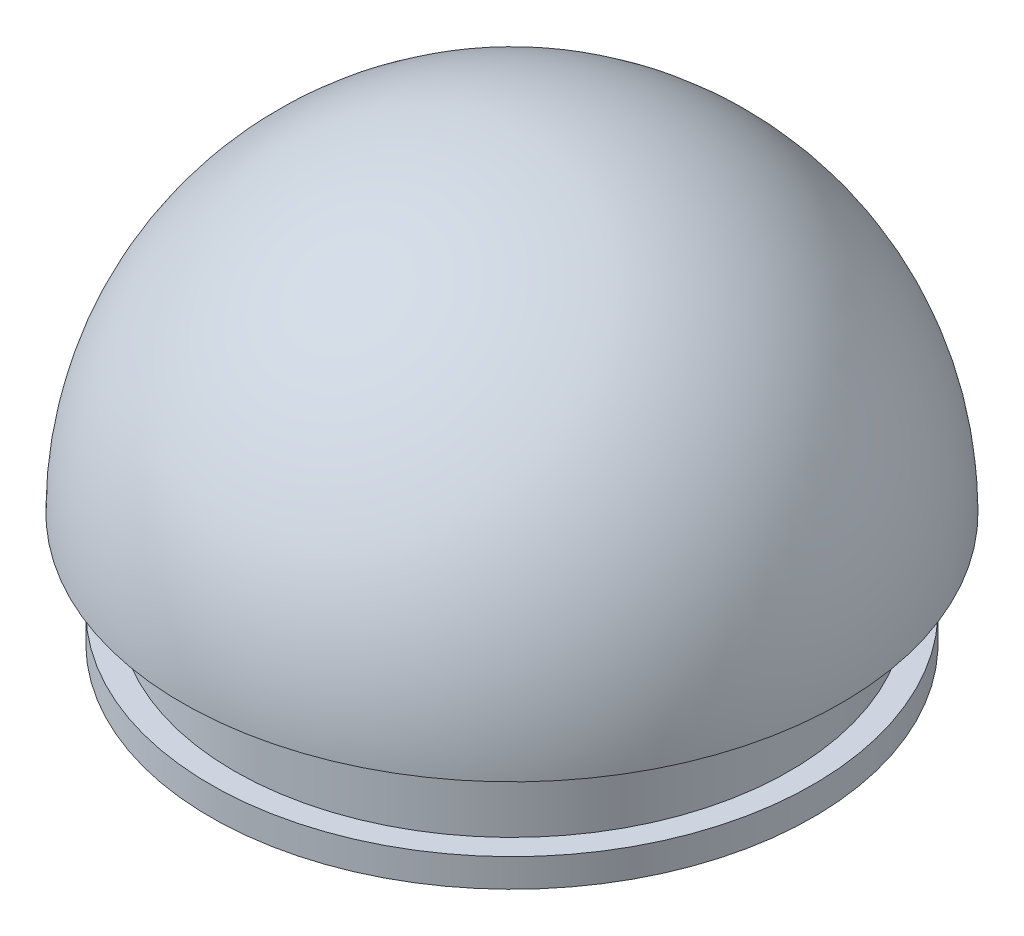
from build123d import *
from build123d.topology import SkipClean

# Parameters (mm, degrees)
CUT_REVOLVE2_ANGLE      = 180
BOSS_EXTRUDE1_START     = -0.0001
BOSS_EXTRUDE1_OUTLINE_R = 33.75
BOSS_EXTRUDE1_DEPTH     = 3.0001
SKETCH7_R               = 29.5
BOSS_EXTRUDE2_DEPTH     = 12
SKETCH8_R               = 32
BOSS_EXTRUDE3_DEPTH     = 3
SKETCH9_R               = 28
CUT_EXTRUDE1_DEPTH      = 16


# Read off the part's stored shape, not the designer's step: Boss-Extrude1
with BuildPart() as part:
    # Sketch1 → Revolve1 (revolve)
    with BuildSketch(Plane.XY):
        with BuildLine():
            Line((35, 0), (-35, 0))
            ThreePointArc((-35, 0), (0, 35), (35, 0))
        make_face()
    revolve(axis=Axis((35, 0, 0), (-1, 0, 0)))

    # Sketch3 → Cut-Revolve1 (revolve, cut)
    with BuildSketch(Plane.XY):
        with BuildLine():
            Line((0.536808441, 33.745730644), (-0.536808441, -33.745730644))
            ThreePointArc((-0.536808441, -33.745730644), (-33.745730644, 0.536808441), (0.536808441, 33.745730644))
        make_face()
    revolve(axis=Axis((0.536808441, 33.745730644, 0), (-0.015905435294566866, -0.9998735005629914, 0)), mode=Mode.SUBTRACT)

    # Sketch5 → Cut-Revolve2 (revolve, cut)
    with SkipClean():  # the faces are left unmerged after this step: merging them gives an invalid solid
        with BuildSketch(Plane(origin=(0, 0, 0), x_dir=(1, 0, 0), z_dir=(0, 1, 0))):
            with BuildLine():
                Line((-35, 0), (35, 0))
                ThreePointArc((35, 0), (0, -35), (-35, 0))
            make_face()
        revolve(axis=Axis((-35, 0, 0), (1, 0, 0)), revolution_arc=CUT_REVOLVE2_ANGLE, mode=Mode.SUBTRACT)

    # Boss-Extrude1 outline → Boss-Extrude1 (add)
    with SkipClean():  # the faces are left unmerged after this step: merging them gives an invalid solid
        with BuildSketch(Plane(origin=(0, 0, 0), x_dir=(1, 0, 0), z_dir=(0, 1, 0)).offset(BOSS_EXTRUDE1_START)):
            Circle(BOSS_EXTRUDE1_OUTLINE_R)
        extrude(amount=BOSS_EXTRUDE1_DEPTH)

    # Sketch7 → Boss-Extrude2 (add)
    with SkipClean():  # the faces are left unmerged after this step: merging them gives an invalid solid
        with BuildSketch(Plane.XZ.offset(0.0001)):
            with Locations(Location((0, 0, 0), (0, 0, 270))):
                Circle(SKETCH7_R)
        extrude(amount=BOSS_EXTRUDE2_DEPTH)

    # Sketch8 → Boss-Extrude3 (add)
    with SkipClean():  # the faces are left unmerged after this step: merging them gives an invalid solid
        with BuildSketch(Plane.XZ.offset(12.0001)):
            with Locations(Location((0, 0, 0), (0, 0, 270))):
                Circle(SKETCH8_R)
        extrude(amount=-BOSS_EXTRUDE3_DEPTH)

    # Sketch9 → Cut-Extrude1 (cut)
    with SkipClean():  # the faces are left unmerged after this step: merging them gives an invalid solid
        with BuildSketch(Plane.XZ.offset(12.0001)):
            with Locations(Location((0, 0, 0), (0, 0, 270))):
                Circle(SKETCH9_R)
        extrude(amount=-CUT_EXTRUDE1_DEPTH, mode=Mode.SUBTRACT)


solid = part.part
